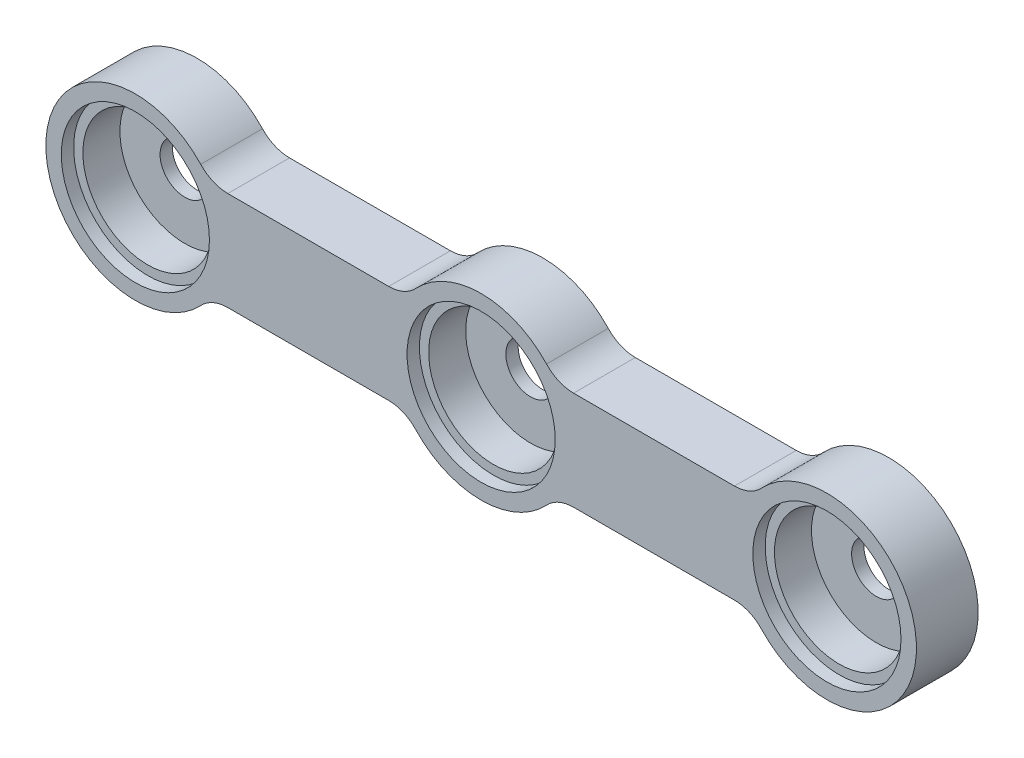
from build123d import *

# Parameters (mm, degrees)
BOSS_EXTRUDE1_DEPTH = 5
SKETCH2_R           = 7.25
BOSS_EXTRUDE2_DEPTH = 5
SKETCH5_R           = 6
CUT_EXTRUDE2_DEPTH  = 1
SKETCH6_R           = 2
CUT_EXTRUDE3_DEPTH  = 4
FILLET1_R           = 3
SKETCH7_R           = 5.25
CUT_EXTRUDE4_DEPTH  = 3


with BuildPart() as part:
    # Sketch1 → Boss-Extrude1 (new body)
    with BuildSketch(Plane.XY):
        with BuildLine():
            Line((-68.758315939, 4), (-12.748315939, 4))
            ThreePointArc((-12.748315939, 4), (-8.748315939, 0), (-12.748315939, -4))
            Line((-12.748315939, -4), (-68.758315939, -4))
            ThreePointArc((-68.758315939, -4), (-72.758315939, 0), (-68.758315939, 4))
        make_face()
    extrude(amount=BOSS_EXTRUDE1_DEPTH)

    # Sketch2 → Boss-Extrude2 (add)
    with BuildSketch(Plane(origin=(0, 0, 0), x_dir=(-1, 0, 0), z_dir=(0, 0, -1))):
        with Locations((40.753315939, 0)):
            Circle(SKETCH2_R)
        with Locations((68.758315939, 0)):
            Circle(SKETCH2_R)
        with Locations((12.748315939, 0)):
            Circle(SKETCH2_R)
    extrude(amount=-BOSS_EXTRUDE2_DEPTH)

    # Sketch5 → Cut-Extrude2 (cut)
    with BuildSketch(Plane.XY.offset(5)):
        with Locations((-68.758315939, 0)):
            Circle(SKETCH5_R)
        with Locations((-40.753315939, 0)):
            Circle(SKETCH5_R)
        with Locations((-12.748315939, 0)):
            Circle(SKETCH5_R)
    extrude(amount=-CUT_EXTRUDE2_DEPTH, mode=Mode.SUBTRACT)

    # Sketch6 → Cut-Extrude3 (cut)
    with BuildSketch(Plane(origin=(0, 0, 0), x_dir=(-1, 0, 0), z_dir=(0, 0, -1))):
        with Locations((12.748315939, 0)):
            Circle(SKETCH6_R)
        with Locations((40.753315939, 0)):
            Circle(SKETCH6_R)
        with Locations((68.758315939, 0)):
            Circle(SKETCH6_R)
    extrude(amount=-CUT_EXTRUDE3_DEPTH, mode=Mode.SUBTRACT)

    # Fillet1
    fillet1_edges = [part.edges().sort_by_distance(p)[0] for p in [
        (-18.79500925, 4, 2.5),
        (-18.79500925, -4, 2.5),
        (-34.706622628, -4, 2.5),
        (-46.80000925, -4, 2.5),
        (-34.706622628, 4, 2.5),
        (-46.80000925, 4, 2.5),
        (-62.711622628, -4, 2.5),
        (-62.711622628, 4, 2.5),
    ]]
    fillet(fillet1_edges, radius=FILLET1_R)

    # Sketch7 → Cut-Extrude4 (cut)
    with BuildSketch(Plane.XY.offset(4)):
        with Locations((-68.758315939, 0)):
            Circle(SKETCH7_R)
        with Locations((-40.753315939, 0)):
            Circle(SKETCH7_R)
        with Locations((-12.748315939, 0)):
            Circle(SKETCH7_R)
    extrude(amount=-CUT_EXTRUDE4_DEPTH, mode=Mode.SUBTRACT)


solid = part.part
